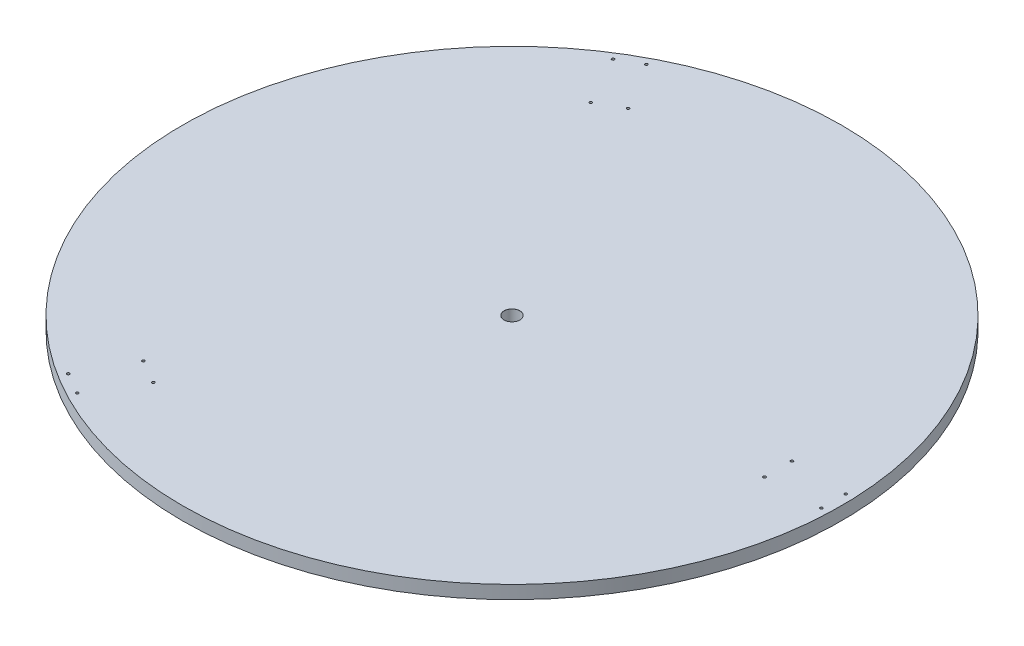
from build123d import *

# Parameters (mm, degrees)
ESQUISSE1_R                  = 250
BOSS_EXTRU_1_DEPTH           = 5
D_GAGEMENT_M101_D            = 12
D_GAGEMENT_M101_CSINK_D      = 12.05
D_GAGEMENT_M101_CSINK_ANGLE  = 90
ESQUISSE6_R                  = 1
ENL_V_MAT_EXTRU_1_DEPTH      = 354.694783677
R_P_TITION_CIRCULAIRE1_COUNT = 3


with BuildPart() as part:
    # Esquisse1 → Boss.-Extru.1 (new, symmetric)
    with BuildSketch(Plane(origin=(0, 0, 0), x_dir=(1, 0, 0), z_dir=(0, 1, 0))):
        Circle(ESQUISSE1_R)
    extrude(amount=BOSS_EXTRU_1_DEPTH, both=True)

    # Dégagement M101 (through all)
    with Locations(Plane(origin=(0, 5, 0), x_dir=(1, 0, 0), z_dir=(0, 1, 0))):
        with Locations((0, 0)):
            CounterSinkHole(D_GAGEMENT_M101_D / 2, D_GAGEMENT_M101_CSINK_D / 2, counter_sink_angle=D_GAGEMENT_M101_CSINK_ANGLE)

    # Esquisse6 → Enlèv. mat.-Extru.1 (cut, through all)
    with BuildSketch(Plane(origin=(0, 5, 0), x_dir=(1, 0, 0), z_dir=(0, 1, 0))):
        with Locations((243.954448956, 9.25)):
            Circle(ESQUISSE6_R)
        with Locations((243.954448956, -9.25)):
            Circle(ESQUISSE6_R)
        with Locations((201.950188458, 10.4)):
            Circle(ESQUISSE6_R)
        with Locations((201.950188458, -10.4)):
            Circle(ESQUISSE6_R)
    enl_v_mat_extru_1 = extrude(amount=-ENL_V_MAT_EXTRU_1_DEPTH, mode=Mode.SUBTRACT)

    # Répétition circulaire1: Enlèv. mat.-Extru.1 ×3 about axis
    r_p_tition_circulaire1_axis = Axis((0, 5, 0), (0, 1, 0))
    for i in range(1, R_P_TITION_CIRCULAIRE1_COUNT):
        add(enl_v_mat_extru_1.rotate(r_p_tition_circulaire1_axis, i * 360 / R_P_TITION_CIRCULAIRE1_COUNT), mode=Mode.SUBTRACT)


solid = part.part
